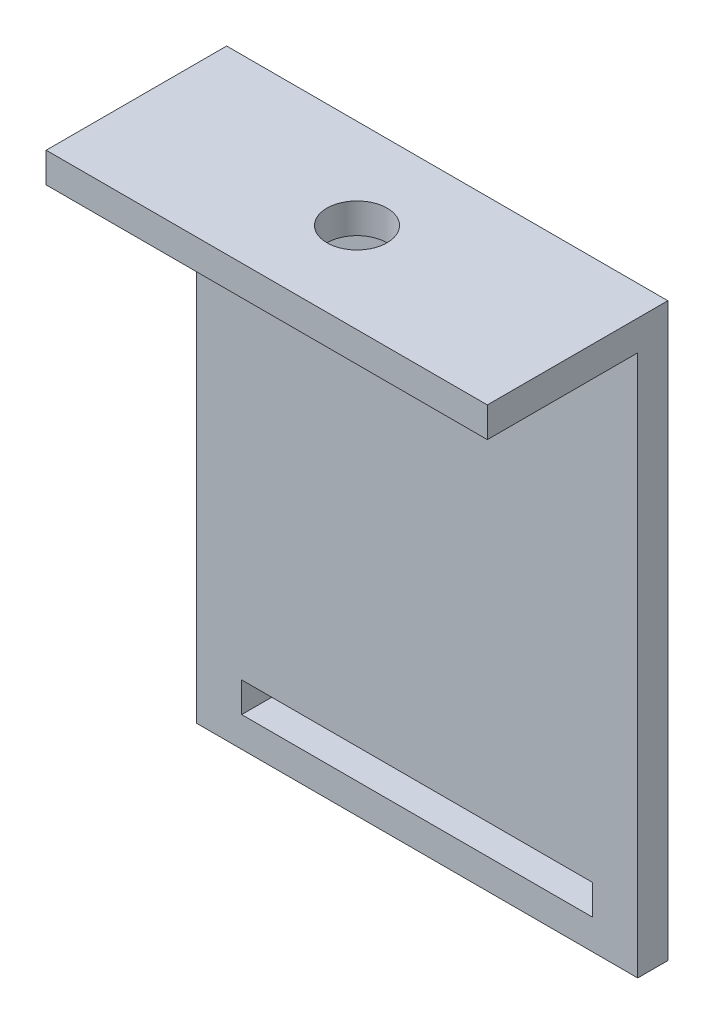
from build123d import *

# Parameters (mm, degrees)
ESTRUSIONE_ESTRUSIONE6_DEPTH = 44
SCHIZZO9_W                   = 35
SCHIZZO9_H                   = 3
TAGLIO_ESTRUSIONE2_DEPTH     = 44
SCHIZZO10_R                  = 3
TAGLIO_ESTRUSIONE3_DEPTH     = 10


with BuildPart() as part:
    # Schizzo8 → Estrusione-Estrusione6 (new body)
    with BuildSketch(Plane(origin=(0, 0, 0), x_dir=(0, 0, -1), z_dir=(1, 0, 0))):
        Polygon((0, 0), (0, 3), (18, 3), (18, -54), (15, -54), (15, 0), align=None)
    extrude(amount=ESTRUSIONE_ESTRUSIONE6_DEPTH)

    # Schizzo9 → Taglio-Estrusione2 (cut)
    with BuildSketch(Plane.XY.offset(-15)):
        with Locations((22, -49.5)):
            Rectangle(SCHIZZO9_W, SCHIZZO9_H)
    extrude(amount=-TAGLIO_ESTRUSIONE2_DEPTH, mode=Mode.SUBTRACT)

    # Schizzo10 → Taglio-Estrusione3 (cut)
    with BuildSketch(Plane(origin=(0, 3, 0), x_dir=(1, 0, 0), z_dir=(0, 1, 0))):
        with Locations((22, 9)):
            Circle(SCHIZZO10_R)
    extrude(amount=-TAGLIO_ESTRUSIONE3_DEPTH, mode=Mode.SUBTRACT)


solid = part.part
